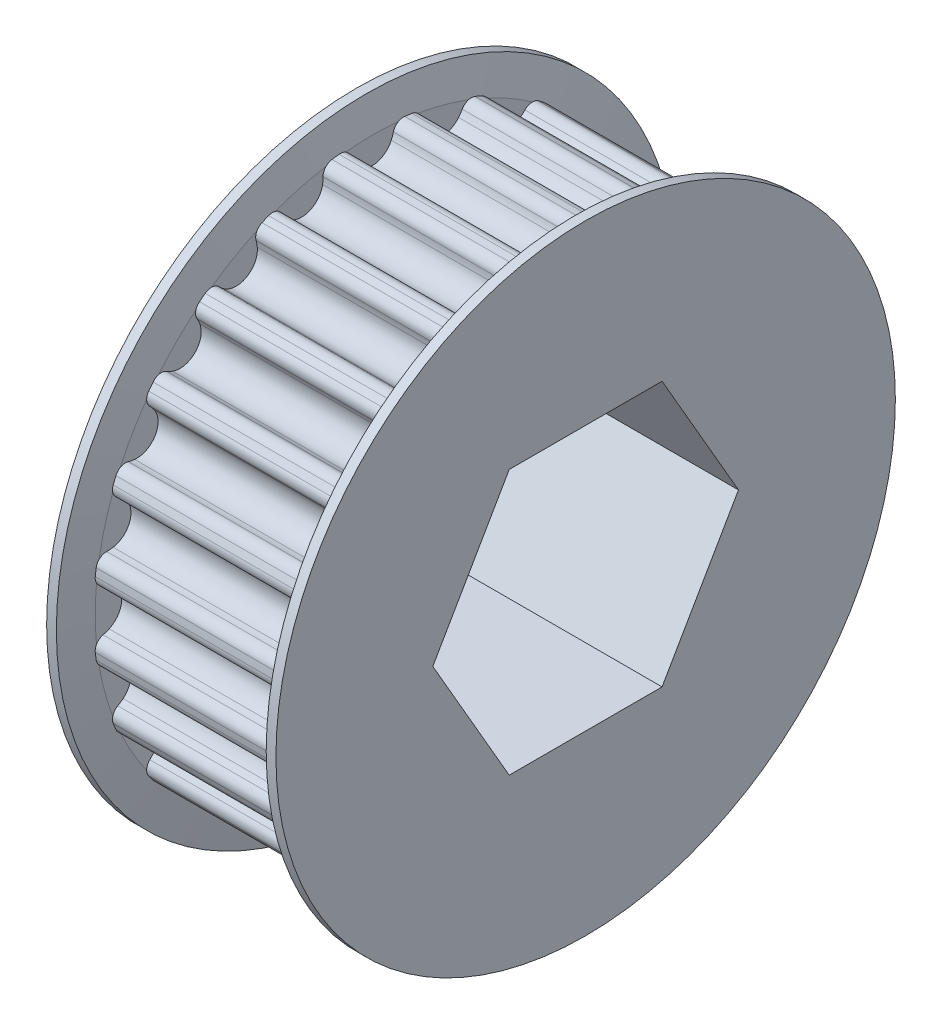
from build123d import *

# Parameters (mm, degrees)
BOSS_EXTRUDE1_DEPTH     = 4.754000017
CUT_EXTRUDE1_DEPTH      = 22.722490998
CUT_EXTRUDE1_DEPTH_BACK = 22.722490998


with BuildPart() as part:
    # Sketch1 → Boss-Extrude1 (new, symmetric)
    with BuildSketch(Plane(origin=(0, 0, 0), x_dir=(0, 0, -1), z_dir=(1, 0, 0))):
        with BuildLine():
            ThreePointArc((5.557566246, 11.685612776), (5.527526108, 12.036559437), (5.273565886, 12.280629458))
            ThreePointArc((5.273565886, 12.280629458), (5.114580281, 12.347689079), (4.954742168, 12.412690566))
            ThreePointArc((4.954742168, 12.412690566), (4.602581606, 12.419683994), (4.333183257, 12.192768815))
            ThreePointArc((4.333183257, 12.192768815), (4.251529891, 12.060664876), (4.158889512, 11.936019446))
            ThreePointArc((4.158889512, 11.936019446), (3.106847627, 11.594913197), (2.366305754, 12.416340816))
            ThreePointArc((2.366305754, 12.416340816), (2.348399548, 12.570607114), (2.343737628, 12.725839165))
            ThreePointArc((2.343737628, 12.725839165), (2.223889403, 13.057052649), (1.915412697, 13.227076444))
            ThreePointArc((1.915412697, 13.227076444), (1.744488087, 13.250702561), (1.573272703, 13.272120029))
            ThreePointArc((1.573272703, 13.272120029), (1.231301689, 13.187729301), (1.029812836, 12.898820645))
            ThreePointArc((1.029812836, 12.898820645), (0.985132756, 12.750084592), (0.927909633, 12.605709258))
            ThreePointArc((0.927909633, 12.605709258), (0, 12.003937447), (-0.927909633, 12.605709258))
            ThreePointArc((-0.927909633, 12.605709258), (-0.985132756, 12.750084592), (-1.029812836, 12.898820645))
            ThreePointArc((-1.029812836, 12.898820645), (-1.231301689, 13.187729301), (-1.573272703, 13.272120029))
            ThreePointArc((-1.573272703, 13.272120029), (-1.744488087, 13.250702561), (-1.915412697, 13.227076444))
            ThreePointArc((-1.915412697, 13.227076444), (-2.223889403, 13.057052649), (-2.343737628, 12.725839165))
            ThreePointArc((-2.343737628, 12.725839165), (-2.348399548, 12.570607114), (-2.366305754, 12.416340816))
            ThreePointArc((-2.366305754, 12.416340816), (-3.106847627, 11.594913197), (-4.158889512, 11.936019446))
            ThreePointArc((-4.158889512, 11.936019446), (-4.251529891, 12.060664876), (-4.333183257, 12.192768815))
            ThreePointArc((-4.333183257, 12.192768815), (-4.602581606, 12.419683994), (-4.954742168, 12.412690566))
            ThreePointArc((-4.954742168, 12.412690566), (-5.114580281, 12.347689079), (-5.273565886, 12.280629458))
            ThreePointArc((-5.273565886, 12.280629458), (-5.527526108, 12.036559437), (-5.557566246, 11.685612776))
            ThreePointArc((-5.557566246, 11.685612776), (-5.521892303, 11.534463536), (-5.499261314, 11.380819267))
            ThreePointArc((-5.499261314, 11.380819267), (-6.001968723, 10.395714774), (-7.106447944, 10.452909633))
            ThreePointArc((-7.106447944, 10.452909633), (-7.228192289, 10.549330779), (-7.341254399, 10.65579994))
            ThreePointArc((-7.341254399, 10.65579994), (-7.660203193, 10.805257748), (-7.998554142, 10.707356755))
            ThreePointArc((-7.998554142, 10.707356755), (-8.13612228, 10.603200992), (-8.272334276, 10.49727787))
            ThreePointArc((-8.272334276, 10.49727787), (-8.454471043, 10.195794591), (-8.392655908, 9.849031187))
            ThreePointArc((-8.392655908, 9.849031187), (-8.319077224, 9.712265328), (-8.257451304, 9.569713692))
            ThreePointArc((-8.257451304, 9.569713692), (-8.488065569, 8.488065569), (-9.569713692, 8.257451304))
            ThreePointArc((-9.569713692, 8.257451304), (-9.712265328, 8.319077224), (-9.849031187, 8.392655908))
            ThreePointArc((-9.849031187, 8.392655908), (-10.195794591, 8.454471043), (-10.49727787, 8.272334276))
            ThreePointArc((-10.49727787, 8.272334276), (-10.603200992, 8.13612228), (-10.707356755, 7.998554142))
            ThreePointArc((-10.707356755, 7.998554142), (-10.805257748, 7.660203193), (-10.65579994, 7.341254399))
            ThreePointArc((-10.65579994, 7.341254399), (-10.549330779, 7.228192289), (-10.452909633, 7.106447944))
            ThreePointArc((-10.452909633, 7.106447944), (-10.395714774, 6.001968723), (-11.380819267, 5.499261314))
            ThreePointArc((-11.380819267, 5.499261314), (-11.534463536, 5.521892303), (-11.685612776, 5.557566246))
            ThreePointArc((-11.685612776, 5.557566246), (-12.036559437, 5.527526108), (-12.280629458, 5.273565886))
            ThreePointArc((-12.280629458, 5.273565886), (-12.347689079, 5.114580281), (-12.412690566, 4.954742168))
            ThreePointArc((-12.412690566, 4.954742168), (-12.419683994, 4.602581606), (-12.192768815, 4.333183257))
            ThreePointArc((-12.192768815, 4.333183257), (-12.060664876, 4.251529891), (-11.936019446, 4.158889512))
            ThreePointArc((-11.936019446, 4.158889512), (-11.594913197, 3.106847627), (-12.416340816, 2.366305754))
            ThreePointArc((-12.416340816, 2.366305754), (-12.570607114, 2.348399548), (-12.725839165, 2.343737628))
            ThreePointArc((-12.725839165, 2.343737628), (-13.057052649, 2.223889403), (-13.227076444, 1.915412697))
            ThreePointArc((-13.227076444, 1.915412697), (-13.250702561, 1.744488087), (-13.272120029, 1.573272703))
            ThreePointArc((-13.272120029, 1.573272703), (-13.187729301, 1.231301689), (-12.898820645, 1.029812836))
            ThreePointArc((-12.898820645, 1.029812836), (-12.750084592, 0.985132756), (-12.605709258, 0.927909633))
            ThreePointArc((-12.605709258, 0.927909633), (-12.003937447, 0), (-12.605709258, -0.927909633))
            ThreePointArc((-12.605709258, -0.927909633), (-12.750084592, -0.985132756), (-12.898820645, -1.029812836))
            ThreePointArc((-12.898820645, -1.029812836), (-13.187729301, -1.231301689), (-13.272120029, -1.573272703))
            ThreePointArc((-13.272120029, -1.573272703), (-13.250702561, -1.744488087), (-13.227076444, -1.915412697))
            ThreePointArc((-13.227076444, -1.915412697), (-13.057052649, -2.223889403), (-12.725839165, -2.343737628))
            ThreePointArc((-12.725839165, -2.343737628), (-12.570607114, -2.348399548), (-12.416340816, -2.366305754))
            ThreePointArc((-12.416340816, -2.366305754), (-11.594913197, -3.106847627), (-11.936019446, -4.158889512))
            ThreePointArc((-11.936019446, -4.158889512), (-12.060664876, -4.251529891), (-12.192768815, -4.333183257))
            ThreePointArc((-12.192768815, -4.333183257), (-12.419683994, -4.602581606), (-12.412690566, -4.954742168))
            ThreePointArc((-12.412690566, -4.954742168), (-12.347689079, -5.114580281), (-12.280629458, -5.273565886))
            ThreePointArc((-12.280629458, -5.273565886), (-12.036559437, -5.527526108), (-11.685612776, -5.557566246))
            ThreePointArc((-11.685612776, -5.557566246), (-11.534463536, -5.521892303), (-11.380819267, -5.499261314))
            ThreePointArc((-11.380819267, -5.499261314), (-10.395714774, -6.001968723), (-10.452909633, -7.106447944))
            ThreePointArc((-10.452909633, -7.106447944), (-10.549330779, -7.228192289), (-10.65579994, -7.341254399))
            ThreePointArc((-10.65579994, -7.341254399), (-10.805257748, -7.660203193), (-10.707356755, -7.998554142))
            ThreePointArc((-10.707356755, -7.998554142), (-10.603200992, -8.13612228), (-10.49727787, -8.272334276))
            ThreePointArc((-10.49727787, -8.272334276), (-10.195794591, -8.454471043), (-9.849031187, -8.392655908))
            ThreePointArc((-9.849031187, -8.392655908), (-9.712265328, -8.319077224), (-9.569713692, -8.257451304))
            ThreePointArc((-9.569713692, -8.257451304), (-8.488065569, -8.488065569), (-8.257451304, -9.569713692))
            ThreePointArc((-8.257451304, -9.569713692), (-8.319077224, -9.712265328), (-8.392655908, -9.849031187))
            ThreePointArc((-8.392655908, -9.849031187), (-8.454471043, -10.195794591), (-8.272334276, -10.49727787))
            ThreePointArc((-8.272334276, -10.49727787), (-8.13612228, -10.603200992), (-7.998554142, -10.707356755))
            ThreePointArc((-7.998554142, -10.707356755), (-7.660203193, -10.805257748), (-7.341254399, -10.65579994))
            ThreePointArc((-7.341254399, -10.65579994), (-7.228192289, -10.549330779), (-7.106447944, -10.452909633))
            ThreePointArc((-7.106447944, -10.452909633), (-6.001968723, -10.395714774), (-5.499261314, -11.380819267))
            ThreePointArc((-5.499261314, -11.380819267), (-5.521892303, -11.534463536), (-5.557566246, -11.685612776))
            ThreePointArc((-5.557566246, -11.685612776), (-5.527526108, -12.036559437), (-5.273565886, -12.280629458))
            ThreePointArc((-5.273565886, -12.280629458), (-5.114580281, -12.347689079), (-4.954742168, -12.412690566))
            ThreePointArc((-4.954742168, -12.412690566), (-4.602581606, -12.419683994), (-4.333183257, -12.192768815))
            ThreePointArc((-4.333183257, -12.192768815), (-4.251529891, -12.060664876), (-4.158889512, -11.936019446))
            ThreePointArc((-4.158889512, -11.936019446), (-3.106847627, -11.594913197), (-2.366305754, -12.416340816))
            ThreePointArc((-2.366305754, -12.416340816), (-2.348399548, -12.570607114), (-2.343737628, -12.725839165))
            ThreePointArc((-2.343737628, -12.725839165), (-2.223889403, -13.057052649), (-1.915412697, -13.227076444))
            ThreePointArc((-1.915412697, -13.227076444), (-1.744488087, -13.250702561), (-1.573272703, -13.272120029))
            ThreePointArc((-1.573272703, -13.272120029), (-1.231301689, -13.187729301), (-1.029812836, -12.898820645))
            ThreePointArc((-1.029812836, -12.898820645), (-0.985132756, -12.750084592), (-0.927909633, -12.605709258))
            ThreePointArc((-0.927909633, -12.605709258), (0, -12.003937447), (0.927909633, -12.605709258))
            ThreePointArc((0.927909633, -12.605709258), (0.985132756, -12.750084592), (1.029812836, -12.898820645))
            ThreePointArc((1.029812836, -12.898820645), (1.231301689, -13.187729301), (1.573272703, -13.272120029))
            ThreePointArc((1.573272703, -13.272120029), (1.744488087, -13.250702561), (1.915412697, -13.227076444))
            ThreePointArc((1.915412697, -13.227076444), (2.223889403, -13.057052649), (2.343737628, -12.725839165))
            ThreePointArc((2.343737628, -12.725839165), (2.348399548, -12.570607114), (2.366305754, -12.416340816))
            ThreePointArc((2.366305754, -12.416340816), (3.106847627, -11.594913197), (4.158889512, -11.936019446))
            ThreePointArc((4.158889512, -11.936019446), (4.251529891, -12.060664876), (4.333183257, -12.192768815))
            ThreePointArc((4.333183257, -12.192768815), (4.602581606, -12.419683994), (4.954742168, -12.412690566))
            ThreePointArc((4.954742168, -12.412690566), (5.114580281, -12.347689079), (5.273565886, -12.280629458))
            ThreePointArc((5.273565886, -12.280629458), (5.527526108, -12.036559437), (5.557566246, -11.685612776))
            ThreePointArc((5.557566246, -11.685612776), (5.521892303, -11.534463536), (5.499261314, -11.380819267))
            ThreePointArc((5.499261314, -11.380819267), (6.001968723, -10.395714774), (7.106447944, -10.452909633))
            ThreePointArc((7.106447944, -10.452909633), (7.228192289, -10.549330779), (7.341254399, -10.65579994))
            ThreePointArc((7.341254399, -10.65579994), (7.660203193, -10.805257748), (7.998554142, -10.707356755))
            ThreePointArc((7.998554142, -10.707356755), (8.13612228, -10.603200992), (8.272334276, -10.49727787))
            ThreePointArc((8.272334276, -10.49727787), (8.454471043, -10.195794591), (8.392655908, -9.849031187))
            ThreePointArc((8.392655908, -9.849031187), (8.319077224, -9.712265328), (8.257451304, -9.569713692))
            ThreePointArc((8.257451304, -9.569713692), (8.488065569, -8.488065569), (9.569713692, -8.257451304))
            ThreePointArc((9.569713692, -8.257451304), (9.712265328, -8.319077224), (9.849031187, -8.392655908))
            ThreePointArc((9.849031187, -8.392655908), (10.195794591, -8.454471043), (10.49727787, -8.272334276))
            ThreePointArc((10.49727787, -8.272334276), (10.603200992, -8.13612228), (10.707356755, -7.998554142))
            ThreePointArc((10.707356755, -7.998554142), (10.805257748, -7.660203193), (10.65579994, -7.341254399))
            ThreePointArc((10.65579994, -7.341254399), (10.549330779, -7.228192289), (10.452909633, -7.106447944))
            ThreePointArc((10.452909633, -7.106447944), (10.395714774, -6.001968723), (11.380819267, -5.499261314))
            ThreePointArc((11.380819267, -5.499261314), (11.534463536, -5.521892303), (11.685612776, -5.557566246))
            ThreePointArc((11.685612776, -5.557566246), (12.036559437, -5.527526108), (12.280629458, -5.273565886))
            ThreePointArc((12.280629458, -5.273565886), (12.347689079, -5.114580281), (12.412690566, -4.954742168))
            ThreePointArc((12.412690566, -4.954742168), (12.419683994, -4.602581606), (12.192768815, -4.333183257))
            ThreePointArc((12.192768815, -4.333183257), (12.060664876, -4.251529891), (11.936019446, -4.158889512))
            ThreePointArc((11.936019446, -4.158889512), (11.594913197, -3.106847627), (12.416340816, -2.366305754))
            ThreePointArc((12.416340816, -2.366305754), (12.570607114, -2.348399548), (12.725839165, -2.343737628))
            ThreePointArc((12.725839165, -2.343737628), (13.057052649, -2.223889403), (13.227076444, -1.915412697))
            ThreePointArc((13.227076444, -1.915412697), (13.250702561, -1.744488087), (13.272120029, -1.573272703))
            ThreePointArc((13.272120029, -1.573272703), (13.187729301, -1.231301689), (12.898820645, -1.029812836))
            ThreePointArc((12.898820645, -1.029812836), (12.750084592, -0.985132756), (12.605709258, -0.927909633))
            ThreePointArc((12.605709258, -0.927909633), (12.003937447, 0), (12.605709258, 0.927909633))
            ThreePointArc((12.605709258, 0.927909633), (12.750084592, 0.985132756), (12.898820645, 1.029812836))
            ThreePointArc((12.898820645, 1.029812836), (13.187729301, 1.231301689), (13.272120029, 1.573272703))
            ThreePointArc((13.272120029, 1.573272703), (13.250702561, 1.744488087), (13.227076444, 1.915412697))
            ThreePointArc((13.227076444, 1.915412697), (13.057052649, 2.223889403), (12.725839165, 2.343737628))
            ThreePointArc((12.725839165, 2.343737628), (12.570607114, 2.348399548), (12.416340816, 2.366305754))
            ThreePointArc((12.416340816, 2.366305754), (11.594913197, 3.106847627), (11.936019446, 4.158889512))
            ThreePointArc((11.936019446, 4.158889512), (12.060664876, 4.251529891), (12.192768815, 4.333183257))
            ThreePointArc((12.192768815, 4.333183257), (12.419683994, 4.602581606), (12.412690566, 4.954742168))
            ThreePointArc((12.412690566, 4.954742168), (12.347689079, 5.114580281), (12.280629458, 5.273565886))
            ThreePointArc((12.280629458, 5.273565886), (12.036559437, 5.527526108), (11.685612776, 5.557566246))
            ThreePointArc((11.685612776, 5.557566246), (11.534463536, 5.521892303), (11.380819267, 5.499261314))
            ThreePointArc((11.380819267, 5.499261314), (10.395714774, 6.001968723), (10.452909633, 7.106447944))
            ThreePointArc((10.452909633, 7.106447944), (10.549330779, 7.228192289), (10.65579994, 7.341254399))
            ThreePointArc((10.65579994, 7.341254399), (10.805257748, 7.660203193), (10.707356755, 7.998554142))
            ThreePointArc((10.707356755, 7.998554142), (10.603200992, 8.13612228), (10.49727787, 8.272334276))
            ThreePointArc((10.49727787, 8.272334276), (10.195794591, 8.454471043), (9.849031187, 8.392655908))
            ThreePointArc((9.849031187, 8.392655908), (9.712265328, 8.319077224), (9.569713692, 8.257451304))
            ThreePointArc((9.569713692, 8.257451304), (8.488065569, 8.488065569), (8.257451304, 9.569713692))
            ThreePointArc((8.257451304, 9.569713692), (8.319077224, 9.712265328), (8.392655908, 9.849031187))
            ThreePointArc((8.392655908, 9.849031187), (8.454471043, 10.195794591), (8.272334276, 10.49727787))
            ThreePointArc((8.272334276, 10.49727787), (8.13612228, 10.603200992), (7.998554142, 10.707356755))
            ThreePointArc((7.998554142, 10.707356755), (7.660203193, 10.805257748), (7.341254399, 10.65579994))
            ThreePointArc((7.341254399, 10.65579994), (7.228192289, 10.549330779), (7.106447944, 10.452909633))
            ThreePointArc((7.106447944, 10.452909633), (6.001968723, 10.395714774), (5.499261314, 11.380819267))
            ThreePointArc((5.499261314, 11.380819267), (5.521892303, 11.534463536), (5.557566246, 11.685612776))
        make_face()
    extrude(amount=BOSS_EXTRUDE1_DEPTH, both=True)

    # Sketch2 → Revolve1 (revolve)
    with BuildSketch(Plane.XY):
        Polygon((-5.500000033, 4.7625), (-4.754000017, 4.7625), (-4.754000017, 13.272120029), (-5.033919099, 14.859620029), (-5.500000033, 14.859620029), align=None)
        Polygon((5.500000033, 14.859620029), (5.500000033, 4.7625), (4.754000017, 4.7625), (4.754000017, 13.272120029), (5.033919099, 14.859620029), align=None)
    revolve(axis=Axis((-8.335696951, 0, 0), (1, 0, 0)))

    # Sketch3 → Cut-Extrude1 (cut, two sides: drawn at the far end of the back side and taken through both)
    with BuildSketch(Plane(origin=(0, 0, 0), x_dir=(0, 0, -1), z_dir=(1, 0, 0)).offset(-CUT_EXTRUDE1_DEPTH_BACK)):
        Polygon((7.332348419, 0), (3.666174209, 6.35), (-3.666174209, 6.35), (-7.332348419, 0), (-3.666174209, -6.35), (3.666174209, -6.35), align=None)
    extrude(amount=CUT_EXTRUDE1_DEPTH + CUT_EXTRUDE1_DEPTH_BACK, mode=Mode.SUBTRACT)


solid = part.part
